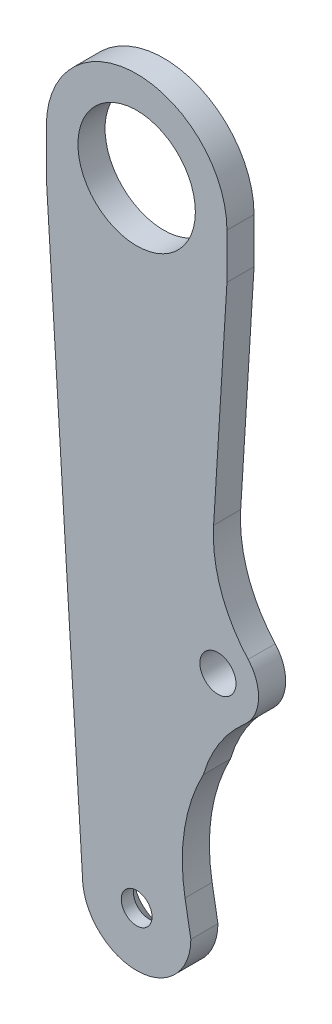
from build123d import *

# Parameters (mm, degrees)
EXTRUDE_1_DEPTH     = 3
SKETCH_2_R          = 6.5
CUT_EXTRUDE_1_DEPTH = 47.19523785
CUT_EXTRUDE_3_DEPTH = 3.5
SKETCH_4_3_R        = 6
EXTRUDE_3_DEPTH     = 3
SKETCH_5_R          = 1.5
CUT_EXTRUDE_4_DEPTH = 47.19523785
SKETCH_6_R          = 4.5
EXTRUDE_4_DEPTH     = 3
FILLET_1_R          = 15
SKETCH_8_R          = 2
CUT_EXTRUDE_5_DEPTH = 48.077064479
CUT_EXTRUDE_9_DEPTH = 48.077064479
FILLET_3_R          = 20


with BuildPart() as part:
    # 草图1 → 凸台-拉伸1 (new body)
    with BuildSketch(Plane.XY):
        with BuildLine():
            ThreePointArc((10, 35), (0, 45), (-10, 35))
            Line((-10, 35), (10, 35))
        make_face()
        with BuildLine():
            Line((10, 35), (-10, 35))
            ThreePointArc((-10, 35), (0, 25), (10, 35))
        make_face()
        with BuildLine():
            ThreePointArc((10, 35), (0, 25), (-10, 35))
            Line((-10, 35), (-10, -35))
            Line((-10, -35), (10, -35))
            Line((10, -35), (10, 35))
        make_face()
    extrude(amount=EXTRUDE_1_DEPTH)

    # 草图2 → 切除-拉伸1 (cut, through all)
    with BuildSketch(Plane.XY.offset(3)):
        with Locations((0, 35)):
            Circle(SKETCH_2_R)
    extrude(amount=-CUT_EXTRUDE_1_DEPTH, mode=Mode.SUBTRACT)

    # 草图4 → 切除-拉伸3 (cut)
    with BuildSketch(Plane(origin=(0, 0, 0), x_dir=(-1, 0, 0), z_dir=(0, 0, -1))):
        Polygon((10, 30), (6, -35), (10, -35), align=None)
        Polygon((-10, -35), (-6, -35), (-10, 30), align=None)
    extrude(amount=-CUT_EXTRUDE_3_DEPTH, mode=Mode.SUBTRACT)

    # 草图4<3> → 凸台-拉伸3 (add)
    with BuildSketch(Plane(origin=(0, 0, 0), x_dir=(-1, 0, 0), z_dir=(0, 0, -1))):
        with Locations((0, -35)):
            Circle(SKETCH_4_3_R)
    extrude(amount=-EXTRUDE_3_DEPTH)

    # 草图5 → 切除-拉伸4 (cut, through all)
    with BuildSketch(Plane(origin=(0, 0, 0), x_dir=(-1, 0, 0), z_dir=(0, 0, -1))):
        with Locations((0, -35)):
            Circle(SKETCH_5_R)
    extrude(amount=-CUT_EXTRUDE_4_DEPTH, mode=Mode.SUBTRACT)

    # 草图6 → 凸台-拉伸4 (add)
    with BuildSketch(Plane(origin=(0, 0, 0), x_dir=(-1, 0, 0), z_dir=(0, 0, -1))):
        with Locations((-9, -8)):
            Circle(SKETCH_6_R)
    extrude(amount=-EXTRUDE_4_DEPTH)

    # 圆角1
    fillet_1_edges = [part.edges().sort_by_distance(p)[0] for p in [
        (7.930527209, -3.628932859, 1.5),
        (7.402648929, -12.206954903, 1.5),
    ]]
    fillet(fillet_1_edges, radius=FILLET_1_R)

    # 草图8 → 切除-拉伸5 (cut, through all)
    with BuildSketch(Plane.XY.offset(3)):
        with Locations((9, -8)):
            Circle(SKETCH_8_R)
    extrude(amount=-CUT_EXTRUDE_5_DEPTH, mode=Mode.SUBTRACT)

    # 草图11 → 切除-拉伸9 (cut, through all)
    with BuildSketch(Plane.XY.offset(3)):
        with BuildLine():
            Line((3.090604818, -18.5), (6, -35))
            Line((6, -35), (6.812082422, -21.803660643))
            ThreePointArc((6.812082422, -21.803660643), (7.00895024, -20.135596552), (7.391074134, -18.5))
            Line((7.391074134, -18.5), (3.090604818, -18.5))
        make_face()
    extrude(amount=-CUT_EXTRUDE_9_DEPTH, mode=Mode.SUBTRACT)

    # 圆角3
    # the kernel refuses this fillet: 20 mm, written as the material it adds along each edge
    with BuildSketch(Plane(origin=(3.090604818, -18.5, 3), x_dir=(1, 0, 0), z_dir=(0, 0, -1))) as fillet_3_piece_1:
        with BuildLine():
            CenterArc((21.962966165, 9.382761056), FILLET_3_R, 170, 37.978360215)
            Line((2.266811105, 12.85572461), (1.872888004, 12.925183881))
            Line((1.872888004, 12.925183881), (-0.393923101, 0.069459271))
            Line((-0.393923101, 0.069459271), (0, -0.4))
            ThreePointArc((0, -0.4), (2.150234658, -0.4), (3.947219379, -0.187655221))
            Line((3.947219379, -0.187655221), (4.300469316, 0))
        make_face()
    extrude(amount=3)

    # 草图14 → M3 六角凹锥坑螺钉的锥形沉头孔2 (revolve, cut)
    with BuildSketch(Plane(origin=(0, -35, 0), x_dir=(0, 1, 0), z_dir=(1, 0, 0))):
        Polygon((0, 0), (0, 3), (1.7, 3), (1.7, 1.66), (3.36, 0), align=None)
    revolve(axis=Axis((0, -35, -6.35), (0, 0, 1)), mode=Mode.SUBTRACT)


solid = part.part
